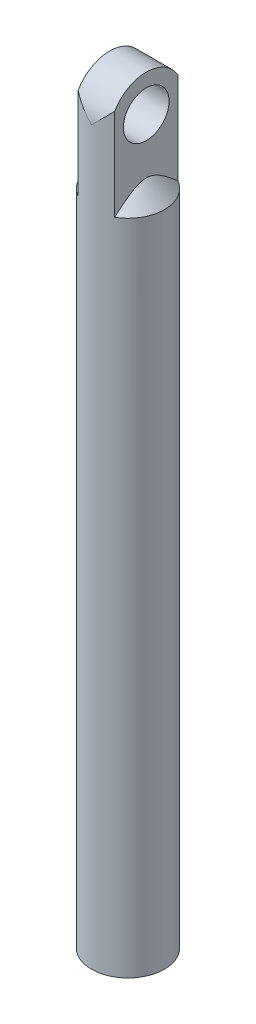
from build123d import *

# Parameters (mm, degrees)
SKETCH1_R                = 4
BOSS_EXTRUDE1_DEPTH      = 55
BOSS_EXTRUDE2_DEPTH      = 2
BOSS_EXTRUDE2_DEPTH_BACK = 2
SKETCH2_R                = 2.5
SKETCH3_R                = 5.5
BOSS_EXTRUDE3_DEPTH      = 3
CHAMFER1_SIZE            = 2
BOSS_EXTRUDE4_START      = 20
SKETCH4_R                = 4
BOSS_EXTRUDE4_DEPTH      = 20
SKETCH5_OUTSIDE_W        = 30.092
SKETCH5_OUTSIDE_H        = 30.092
SKETCH5_OUTSIDE_R        = 4
CUT_EXTRUDE1_DEPTH       = 85.393094269
CHAMFER2_SIZE            = 3
CHAMFER3_SIZE            = 3


with BuildPart() as part:
    # Sketch1 → Boss-Extrude1 (new body)
    with BuildSketch(Plane(origin=(0, 0, 0), x_dir=(1, 0, 0), z_dir=(0, 1, 0))):
        with Locations(Location((0, 0, 0), (0, 0, 270))):
            Circle(SKETCH1_R)
    extrude(amount=BOSS_EXTRUDE1_DEPTH)

    # Sketch2 → Boss-Extrude2 (add, two sides: drawn at the far end of the back side and taken through both)
    with BuildSketch(Plane(origin=(0, 0, 0), x_dir=(0, 0, -1), z_dir=(1, 0, 0)).offset(-BOSS_EXTRUDE2_DEPTH_BACK)):
        with BuildLine():
            Line((-4, 60.033888167), (-4, 55))
            Line((-4, 55), (4, 55))
            Line((4, 55), (4, 60.033888167))
            ThreePointArc((4, 60.033888167), (0, 64.033888167), (-4, 60.033888167))
        make_face()
        with Locations((0, 60.033888167)):
            Circle(SKETCH2_R, mode=Mode.SUBTRACT)
    extrude(amount=BOSS_EXTRUDE2_DEPTH + BOSS_EXTRUDE2_DEPTH_BACK)

    # Sketch3 → Boss-Extrude3 (add)
    with BuildSketch(Plane.XZ.offset(-55)):
        with Locations(Location((0, 0, 0), (0, 0, 270))):
            Circle(SKETCH3_R)
    extrude(amount=BOSS_EXTRUDE3_DEPTH)

    # Chamfer1
    # the kernel refuses this chamfer: 2 mm, written as the material it takes off along each edge
    with BuildSketch(Plane(origin=(0, 52, 0), x_dir=(0, 0, -1), z_dir=(-1, 0, 0))) as chamfer1_piece_1_section:
        Polygon((5.5 - CHAMFER1_SIZE, 0), (5.5, -CHAMFER1_SIZE), (5.5, 0), align=None)
    chamfer1_piece_1 = revolve(axis=Axis((0, 52, 0), (0, -1, 0)), mode=Mode.PRIVATE)
    chamfer1_piece_1 = chamfer1_piece_1 - Plane(origin=(0, 53.250152147, 0), x_dir=(0, 0, 1), z_dir=(0, -1, 0)) * Cylinder(4, 22, mode=Mode.PRIVATE)
    add(chamfer1_piece_1, mode=Mode.SUBTRACT)

    # Sketch4 → Boss-Extrude4 (add)
    with BuildSketch(Plane.XZ.offset(BOSS_EXTRUDE4_START)):
        with Locations(Location((0, 0, 0), (0, 0, 270))):
            Circle(SKETCH4_R)
    extrude(amount=-BOSS_EXTRUDE4_DEPTH)

    # Sketch5 outside → Cut-Extrude1 (cut, through all)
    with BuildSketch(Plane.XZ.offset(20)):
        Rectangle(SKETCH5_OUTSIDE_W, SKETCH5_OUTSIDE_H)
        with Locations(Location((0, 0, 0), (0, 0, 270))):
            Circle(SKETCH5_OUTSIDE_R, mode=Mode.SUBTRACT)
    extrude(amount=-CUT_EXTRUDE1_DEPTH, mode=Mode.SUBTRACT)

    # Chamfer2
    # the kernel refuses this chamfer: 3 mm, written as the material it takes off along each edge
    with BuildSketch(Plane(origin=(0, 55, 0), x_dir=(-0.9865404268898706, 0, -0.16351754068586014), z_dir=(-0.16351754068586014, 0, 0.9865404268898706))) as chamfer2_piece_1_section:
        Polygon((4, CHAMFER2_SIZE), (4 - CHAMFER2_SIZE, 0), (4, 0), align=None)
    chamfer2_piece_1 = revolve(axis=Axis((0, 55, 0), (0, -1, 0)), revolution_arc=341.177747572, mode=Mode.PRIVATE)
    chamfer2_piece_1 = split(chamfer2_piece_1, bisect_by=Plane(origin=(2, 53.817100825, 1e-09), z_dir=(1, 0, 0)), keep=Keep.TOP, mode=Mode.PRIVATE)
    add(chamfer2_piece_1, mode=Mode.SUBTRACT)

    # Chamfer3
    # the kernel refuses this chamfer: 3 mm, written as the material it takes off along each edge
    with BuildSketch(Plane(origin=(0, 55, 0), x_dir=(0.9865404268898706, 0, 0.16351754068586002), z_dir=(0.16351754068586002, 0, -0.9865404268898706))) as chamfer3_piece_1_section:
        Polygon((4, CHAMFER3_SIZE), (4 - CHAMFER3_SIZE, 0), (4, 0), align=None)
    chamfer3_piece_1 = revolve(axis=Axis((0, 55, 0), (0, -1, 0)), revolution_arc=341.177747572, mode=Mode.PRIVATE)
    chamfer3_piece_1 = split(chamfer3_piece_1, bisect_by=Plane(origin=(-2, 53.794161032, -4e-09), z_dir=(-1, 0, 0)), keep=Keep.TOP, mode=Mode.PRIVATE)
    add(chamfer3_piece_1, mode=Mode.SUBTRACT)


solid = part.part
